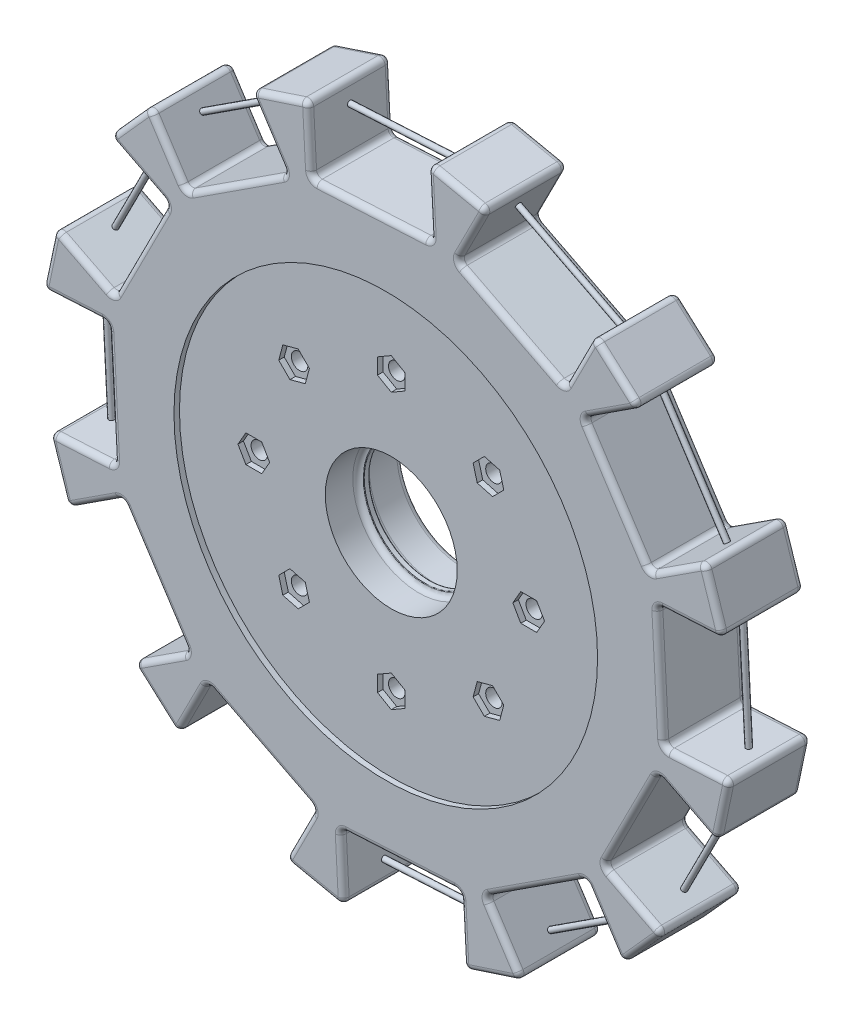
from build123d import *

# Parameters (mm, degrees)
BOSS_EXTRUDE1_DEPTH  = 15
SKETCH3_R            = 12
CUT_EXTRUDE1_DEPTH   = 7
CUT_EXTRUDE2_START   = -7
SKETCH4_R            = 12
CUT_EXTRUDE2_DEPTH   = 7
SKETCH5_R            = 11
CUT_EXTRUDE3_DEPTH   = 7
FILLET1_R            = 1
FILLET2_R            = 1
FILLET3_R            = 0.1
SKETCH6_R            = 1.5
CUT_EXTRUDE4_DEPTH   = 37
CUT_EXTRUDE5_DEPTH   = 2
CUT_EXTRUDE6_DEPTH   = 2
SKETCH9_R            = 0.5
BOSS_EXTRUDE2_DEPTH  = 23
SKETCH10_R           = 0.5
BOSS_EXTRUDE3_DEPTH  = 23
SKETCH11_R           = 0.5
BOSS_EXTRUDE4_DEPTH  = 23
SKETCH12_R           = 0.5
BOSS_EXTRUDE5_DEPTH  = 23
SKETCH13_R           = 0.5
BOSS_EXTRUDE6_DEPTH  = 23
SKETCH14_R           = 0.5
BOSS_EXTRUDE7_DEPTH  = 23
SKETCH15_R           = 0.5
BOSS_EXTRUDE8_DEPTH  = 23
SKETCH16_R           = 0.5
BOSS_EXTRUDE9_DEPTH  = 23
SKETCH17_R           = 0.5
BOSS_EXTRUDE10_DEPTH = 23
SKETCH18_R           = 0.5
BOSS_EXTRUDE11_DEPTH = 23
SKETCH19_R           = 0.5
BOSS_EXTRUDE12_DEPTH = 23
SKETCH20_R           = 0.5
BOSS_EXTRUDE13_DEPTH = 23
SKETCH23_R           = 38.523903913
CUT_EXTRUDE8_DEPTH   = 1
SKETCH24_R           = 1
BOSS_EXTRUDE14_DEPTH = 1
FILLET4_R            = 0.5
SKETCH25_R           = 1
CUT_EXTRUDE9_DEPTH   = 1
FILLET5_R            = 0.5


with BuildPart() as part:
    # Sketch1 → Boss-Extrude1 (new body)
    with BuildSketch(Plane.XY):
        with BuildLine():
            Line((-18.67460281, 48.693057371), (-23.963115728, 56.82298102))
            ThreePointArc((-23.963115728, 56.82298102), (-24.067993911, 57.700686954), (-23.435941035, 58.318648361))
            Line((-23.435941035, 58.318648361), (-15.41218335, 60.944964427))
            ThreePointArc((-15.41218335, 60.944964427), (-14.535909679, 60.819536384), (-14.102516823, 60.047682529))
            Line((-14.102516823, 60.047682529), (-13.586792283, 50.349545451))
            ThreePointArc((-13.586792283, 50.349545451), (-13.256763068, 49.658989765), (-12.535100564, 49.404059053))
            Line((-12.535100564, 49.404059053), (7.228361849, 50.455034357))
            ThreePointArc((7.228361849, 50.455034357), (7.918917534, 50.785063572), (8.173848247, 51.506726076))
            Line((8.173848247, 51.506726076), (7.658823536, 61.191702946))
            ThreePointArc((7.658823536, 61.191702946), (8.006849332, 62.004257673), (8.863203883, 62.223401512))
            Line((8.863203883, 62.223401512), (17.125139904, 60.485979101))
            ThreePointArc((17.125139904, 60.485979101), (17.821301143, 59.939218395), (17.810703439, 59.05407692))
            Line((17.810703439, 59.05407692), (13.408265453, 50.397381571))
            ThreePointArc((13.408265453, 50.397381571), (13.348801294, 49.634328197), (13.846313999, 49.052720472))
            Line((13.846313999, 49.052720472), (31.487462167, 40.081160577))
            ThreePointArc((31.487462167, 40.081160577), (32.250515541, 40.021696419), (32.832123266, 40.519209124))
            Line((32.832123266, 40.519209124), (37.228587219, 49.164157484))
            ThreePointArc((37.228587219, 49.164157484), (37.936263762, 49.693837622), (38.787460477, 49.455444478))
            Line((38.787460477, 49.455444478), (45.073795751, 43.819824522))
            ThreePointArc((45.073795751, 43.819824522), (45.403308716, 42.998235241), (44.951560097, 42.23697909))
            Line((44.951560097, 42.23697909), (36.810589288, 36.941279998))
            ThreePointArc((36.810589288, 36.941279998), (36.377565129, 36.310188471), (36.517619908, 35.557745054))
            Line((36.517619908, 35.557745054), (47.309522426, 18.967572189))
            ThreePointArc((47.309522426, 18.967572189), (47.940613953, 18.534548031), (48.693057371, 18.67460281))
            Line((48.693057371, 18.67460281), (56.82298102, 23.963115728))
            ThreePointArc((56.82298102, 23.963115728), (57.700686954, 24.067993911), (58.318648361, 23.435941035))
            Line((58.318648361, 23.435941035), (60.944964427, 15.41218335))
            ThreePointArc((60.944964427, 15.41218335), (60.819536384, 14.535909679), (60.047682529, 14.102516823))
            Line((60.047682529, 14.102516823), (50.349545451, 13.586792283))
            ThreePointArc((50.349545451, 13.586792283), (49.658989765, 13.256763068), (49.404059053, 12.535100564))
            Line((49.404059053, 12.535100564), (50.455034357, -7.228361849))
            ThreePointArc((50.455034357, -7.228361849), (50.785063572, -7.918917534), (51.506726076, -8.173848247))
            Line((51.506726076, -8.173848247), (61.191702946, -7.658823536))
            ThreePointArc((61.191702946, -7.658823536), (62.004257673, -8.006849332), (62.223401512, -8.863203883))
            Line((62.223401512, -8.863203883), (60.485979101, -17.125139904))
            ThreePointArc((60.485979101, -17.125139904), (59.939218395, -17.821301143), (59.05407692, -17.810703439))
            Line((59.05407692, -17.810703439), (50.397381571, -13.408265453))
            ThreePointArc((50.397381571, -13.408265453), (49.634328197, -13.348801294), (49.052720472, -13.846313999))
            Line((49.052720472, -13.846313999), (40.081160577, -31.487462167))
            ThreePointArc((40.081160577, -31.487462167), (40.021696419, -32.250515541), (40.519209124, -32.832123266))
            Line((40.519209124, -32.832123266), (49.164157484, -37.228587219))
            ThreePointArc((49.164157484, -37.228587219), (49.693837622, -37.936263762), (49.455444478, -38.787460477))
            Line((49.455444478, -38.787460477), (43.819824522, -45.073795751))
            ThreePointArc((43.819824522, -45.073795751), (42.998235241, -45.403308716), (42.23697909, -44.951560097))
            Line((42.23697909, -44.951560097), (36.941279998, -36.810589288))
            ThreePointArc((36.941279998, -36.810589288), (36.310188471, -36.377565129), (35.557745054, -36.517619908))
            Line((35.557745054, -36.517619908), (18.967572189, -47.309522426))
            ThreePointArc((18.967572189, -47.309522426), (18.534548031, -47.940613953), (18.67460281, -48.693057371))
            Line((18.67460281, -48.693057371), (23.963115728, -56.82298102))
            ThreePointArc((23.963115728, -56.82298102), (24.067993911, -57.700686954), (23.435941035, -58.318648361))
            Line((23.435941035, -58.318648361), (15.41218335, -60.944964427))
            ThreePointArc((15.41218335, -60.944964427), (14.535909679, -60.819536384), (14.102516823, -60.047682529))
            Line((14.102516823, -60.047682529), (13.586792283, -50.349545451))
            ThreePointArc((13.586792283, -50.349545451), (13.256763068, -49.658989765), (12.535100564, -49.404059053))
            Line((12.535100564, -49.404059053), (-7.228361849, -50.455034357))
            ThreePointArc((-7.228361849, -50.455034357), (-7.918917534, -50.785063572), (-8.173848247, -51.506726076))
            Line((-8.173848247, -51.506726076), (-7.658823536, -61.191702946))
            ThreePointArc((-7.658823536, -61.191702946), (-8.006849332, -62.004257673), (-8.863203883, -62.223401512))
            Line((-8.863203883, -62.223401512), (-17.125139904, -60.485979101))
            ThreePointArc((-17.125139904, -60.485979101), (-17.821301143, -59.939218395), (-17.810703439, -59.05407692))
            Line((-17.810703439, -59.05407692), (-13.408265453, -50.397381571))
            ThreePointArc((-13.408265453, -50.397381571), (-13.348801294, -49.634328197), (-13.846313999, -49.052720472))
            Line((-13.846313999, -49.052720472), (-31.487462167, -40.081160577))
            ThreePointArc((-31.487462167, -40.081160577), (-32.250515541, -40.021696419), (-32.832123266, -40.519209124))
            Line((-32.832123266, -40.519209124), (-37.228587219, -49.164157484))
            ThreePointArc((-37.228587219, -49.164157484), (-37.936263762, -49.693837622), (-38.787460477, -49.455444478))
            Line((-38.787460477, -49.455444478), (-45.073795751, -43.819824522))
            ThreePointArc((-45.073795751, -43.819824522), (-45.403308716, -42.998235241), (-44.951560097, -42.23697909))
            Line((-44.951560097, -42.23697909), (-36.810589288, -36.941279998))
            ThreePointArc((-36.810589288, -36.941279998), (-36.377565129, -36.310188471), (-36.517619908, -35.557745054))
            Line((-36.517619908, -35.557745054), (-47.309522426, -18.967572189))
            ThreePointArc((-47.309522426, -18.967572189), (-47.940613953, -18.534548031), (-48.693057371, -18.67460281))
            Line((-48.693057371, -18.67460281), (-56.82298102, -23.963115728))
            ThreePointArc((-56.82298102, -23.963115728), (-57.700686954, -24.067993911), (-58.318648361, -23.435941035))
            Line((-58.318648361, -23.435941035), (-60.944964427, -15.41218335))
            ThreePointArc((-60.944964427, -15.41218335), (-60.819536384, -14.535909679), (-60.047682529, -14.102516823))
            Line((-60.047682529, -14.102516823), (-50.349545451, -13.586792283))
            ThreePointArc((-50.349545451, -13.586792283), (-49.658989765, -13.256763068), (-49.404059053, -12.535100564))
            Line((-49.404059053, -12.535100564), (-50.455034357, 7.228361849))
            ThreePointArc((-50.455034357, 7.228361849), (-50.785063572, 7.918917534), (-51.506726076, 8.173848247))
            Line((-51.506726076, 8.173848247), (-61.191702946, 7.658823536))
            ThreePointArc((-61.191702946, 7.658823536), (-62.004257673, 8.006849332), (-62.223401512, 8.863203883))
            Line((-62.223401512, 8.863203883), (-60.485979101, 17.125139904))
            ThreePointArc((-60.485979101, 17.125139904), (-59.939218395, 17.821301143), (-59.05407692, 17.810703439))
            Line((-59.05407692, 17.810703439), (-50.397381571, 13.408265453))
            ThreePointArc((-50.397381571, 13.408265453), (-49.634328197, 13.348801294), (-49.052720472, 13.846313999))
            Line((-49.052720472, 13.846313999), (-40.081160577, 31.487462167))
            ThreePointArc((-40.081160577, 31.487462167), (-40.021696419, 32.250515541), (-40.519209124, 32.832123266))
            Line((-40.519209124, 32.832123266), (-49.164157484, 37.228587219))
            ThreePointArc((-49.164157484, 37.228587219), (-49.693837622, 37.936263762), (-49.455444478, 38.787460477))
            Line((-49.455444478, 38.787460477), (-43.819824522, 45.073795751))
            ThreePointArc((-43.819824522, 45.073795751), (-42.998235241, 45.403308716), (-42.23697909, 44.951560097))
            Line((-42.23697909, 44.951560097), (-36.941279998, 36.810589288))
            ThreePointArc((-36.941279998, 36.810589288), (-36.310188471, 36.377565129), (-35.557745054, 36.517619908))
            Line((-35.557745054, 36.517619908), (-18.967572189, 47.309522426))
            ThreePointArc((-18.967572189, 47.309522426), (-18.534548031, 47.940613953), (-18.67460281, 48.693057371))
        make_face()
    extrude(amount=BOSS_EXTRUDE1_DEPTH)

    # Sketch3 → Cut-Extrude1 (cut)
    with BuildSketch(Plane.XY.offset(15)):
        Circle(SKETCH3_R)
    extrude(amount=-CUT_EXTRUDE1_DEPTH, mode=Mode.SUBTRACT)

    # Sketch4 → Cut-Extrude2 (cut)
    with BuildSketch(Plane(origin=(0, 0, 0), x_dir=(-1, 0, 0), z_dir=(0, 0, -1)).offset(CUT_EXTRUDE2_START)):
        with Locations(Location((0, 0, 0), (0, 0, 180))):
            Circle(SKETCH4_R)
    extrude(amount=CUT_EXTRUDE2_DEPTH, mode=Mode.SUBTRACT)

    # Sketch5 → Cut-Extrude3 (cut)
    with BuildSketch(Plane(origin=(0, 0, 7), x_dir=(-1, 0, 0), z_dir=(0, 0, -1))):
        Circle(SKETCH5_R)
    extrude(amount=-CUT_EXTRUDE3_DEPTH, mode=Mode.SUBTRACT)

    # Fillet1
    fillet1_edges = [part.edges().sort_by_distance(p)[0] for p in [
        (49.658989765, 13.256763068, 0),
        (49.929546705, 2.653369357, 0),
        (-36.377565129, -36.310188471, 15),
        (50.785063572, -7.918917534, 0),
        (56.349214511, -7.916335891, 0),
        (62.004257673, -8.006849332, 0),
        (61.354690307, -12.994171894, 0),
        (59.939218395, -17.821301143, 0),
        (54.725729245, -15.609484446, 0),
        (49.634328197, -13.348801294, 0),
        (44.566940525, -22.666888083, 0),
        (40.021696419, -32.250515541, 0),
        (44.841683304, -35.030355242, 0),
        (-40.881074693, -39.589129544, 15),
        (49.693837622, -37.936263762, 0),
        (46.6376345, -41.930628114, 0),
        (42.998235241, -45.403308716, 0),
        (39.589129544, -40.881074693, 0),
        (36.310188471, -36.377565129, 0),
        (27.262658622, -41.913571167, 0),
        (18.534548031, -47.940613953, 0),
        (21.318859269, -52.758019195, 0),
        (24.067993911, -57.700686954, 0),
        (19.424062192, -59.631806394, 0),
        (-45.403308716, -42.998235241, 15),
        (14.535909679, -60.819536384, 0),
        (13.844654553, -55.19861399, 0),
        (13.256763068, -49.658989765, 0),
        (2.653369357, -49.929546705, 0),
        (-7.918917534, -50.785063572, 0),
        (-7.916335891, -56.349214511, 0),
        (-8.006849332, -62.004257673, 0),
        (-12.994171894, -61.354690307, 0),
        (-17.821301143, -59.939218395, 0),
        (-15.609484446, -54.725729245, 0),
        (-41.930628114, -46.6376345, 15),
        (-13.348801294, -49.634328197, 0),
        (-22.666888083, -44.566940525, 0),
        (-32.250515541, -40.021696419, 0),
        (-35.030355242, -44.841683304, 0),
        (-37.936263762, -49.693837622, 0),
        (-41.930628114, -46.6376345, 0),
        (-45.403308716, -42.998235241, 0),
        (-40.881074693, -39.589129544, 0),
        (-36.377565129, -36.310188471, 0),
        (-41.913571167, -27.262658622, 0),
        (-37.936263762, -49.693837622, 15),
        (-47.940613953, -18.534548031, 0),
        (-52.758019195, -21.318859269, 0),
        (-57.700686954, -24.067993911, 0),
        (-59.631806394, -19.424062192, 0),
        (-60.819536384, -14.535909679, 0),
        (-55.19861399, -13.844654553, 0),
        (-49.658989765, -13.256763068, 0),
        (-49.929546705, -2.653369357, 0),
        (-50.785063572, 7.918917534, 0),
        (-56.349214511, 7.916335891, 0),
        (-35.030355242, -44.841683304, 15),
        (-62.004257673, 8.006849332, 0),
        (-61.354690307, 12.994171894, 0),
        (-59.939218395, 17.821301143, 0),
        (-54.725729245, 15.609484446, 0),
        (-49.634328197, 13.348801294, 0),
        (-44.566940525, 22.666888083, 0),
        (-40.021696419, 32.250515541, 0),
        (-44.841683304, 35.030355242, 0),
        (-49.693837622, 37.936263762, 0),
        (-46.6376345, 41.930628114, 0),
        (-32.250515541, -40.021696419, 15),
        (-42.998235241, 45.403308716, 0),
        (-39.589129544, 40.881074693, 0),
        (-36.310188471, 36.377565129, 0),
        (-22.666888083, -44.566940525, 15),
        (-42.998235241, 45.403308716, 15),
        (-13.348801294, -49.634328197, 15),
        (-15.609484446, -54.725729245, 15),
        (-17.821301143, -59.939218395, 15),
        (-12.994171894, -61.354690307, 15),
        (-8.006849332, -62.004257673, 15),
        (-7.916335891, -56.349214511, 15),
        (-7.918917534, -50.785063572, 15),
        (2.653369357, -49.929546705, 15),
        (13.256763068, -49.658989765, 15),
        (13.844654553, -55.19861399, 15),
        (-46.6376345, 41.930628114, 15),
        (14.535909679, -60.819536384, 15),
        (19.424062192, -59.631806394, 15),
        (24.067993911, -57.700686954, 15),
        (21.318859269, -52.758019195, 15),
        (18.534548031, -47.940613953, 15),
        (27.262658622, -41.913571167, 15),
        (36.310188471, -36.377565129, 15),
        (39.589129544, -40.881074693, 15),
        (42.998235241, -45.403308716, 15),
        (46.6376345, -41.930628114, 15),
        (-49.693837622, 37.936263762, 15),
        (49.693837622, -37.936263762, 15),
        (44.841683304, -35.030355242, 15),
        (40.021696419, -32.250515541, 15),
        (44.566940525, -22.666888083, 15),
        (49.634328197, -13.348801294, 15),
        (54.725729245, -15.609484446, 15),
        (59.939218395, -17.821301143, 15),
        (61.354690307, -12.994171894, 15),
        (62.004257673, -8.006849332, 15),
        (56.349214511, -7.916335891, 15),
        (-44.841683304, 35.030355242, 15),
        (50.785063572, -7.918917534, 15),
        (-12, 0, 15),
        (49.929546705, 2.653369357, 15),
        (-12, 0, 0),
        (49.658989765, 13.256763068, 15),
        (55.19861399, 13.844654553, 15),
        (60.819536384, 14.535909679, 15),
        (59.631806394, 19.424062192, 15),
        (57.700686954, 24.067993911, 15),
        (52.758019195, 21.318859269, 15),
        (47.940613953, 18.534548031, 15),
        (41.913571167, 27.262658622, 15),
        (-40.021696419, 32.250515541, 15),
        (36.377565129, 36.310188471, 15),
        (40.881074693, 39.589129544, 15),
        (45.403308716, 42.998235241, 15),
        (41.930628114, 46.6376345, 15),
        (37.936263762, 49.693837622, 15),
        (35.030355242, 44.841683304, 15),
        (32.250515541, 40.021696419, 15),
        (22.666888083, 44.566940525, 15),
        (13.348801294, 49.634328197, 15),
        (15.609484446, 54.725729245, 15),
        (-44.566940525, 22.666888083, 15),
        (17.821301143, 59.939218395, 15),
        (12.994171894, 61.354690307, 15),
        (8.006849332, 62.004257673, 15),
        (7.916335891, 56.349214511, 15),
        (7.918917534, 50.785063572, 15),
        (-2.653369357, 49.929546705, 15),
        (-13.256763068, 49.658989765, 15),
        (-13.844654553, 55.19861399, 15),
        (-14.535909679, 60.819536384, 15),
        (-19.424062192, 59.631806394, 15),
        (-49.634328197, 13.348801294, 15),
        (-24.067993911, 57.700686954, 15),
        (-21.318859269, 52.758019195, 15),
        (-18.534548031, 47.940613953, 15),
        (-27.262658622, 41.913571167, 15),
        (-54.725729245, 15.609484446, 15),
        (-59.939218395, 17.821301143, 15),
        (-61.354690307, 12.994171894, 15),
        (-36.310188471, 36.377565129, 15),
        (-62.004257673, 8.006849332, 15),
        (-56.349214511, 7.916335891, 15),
        (-50.785063572, 7.918917534, 15),
        (-49.929546705, -2.653369357, 15),
        (-49.658989765, -13.256763068, 15),
        (-55.19861399, -13.844654553, 15),
        (-60.819536384, -14.535909679, 15),
        (-59.631806394, -19.424062192, 15),
        (-57.700686954, -24.067993911, 15),
        (-27.262658622, 41.913571167, 0),
        (-18.534548031, 47.940613953, 0),
        (-21.318859269, 52.758019195, 0),
        (-52.758019195, -21.318859269, 15),
        (-24.067993911, 57.700686954, 0),
        (-19.424062192, 59.631806394, 0),
        (-14.535909679, 60.819536384, 0),
        (-39.589129544, 40.881074693, 15),
        (-13.844654553, 55.19861399, 0),
        (-13.256763068, 49.658989765, 0),
        (-2.653369357, 49.929546705, 0),
        (7.918917534, 50.785063572, 0),
        (7.916335891, 56.349214511, 0),
        (8.006849332, 62.004257673, 0),
        (12.994171894, 61.354690307, 0),
        (-47.940613953, -18.534548031, 15),
        (17.821301143, 59.939218395, 0),
        (15.609484446, 54.725729245, 0),
        (13.348801294, 49.634328197, 0),
        (22.666888083, 44.566940525, 0),
        (32.250515541, 40.021696419, 0),
        (35.030355242, 44.841683304, 0),
        (37.936263762, 49.693837622, 0),
        (41.930628114, 46.6376345, 0),
        (45.403308716, 42.998235241, 0),
        (40.881074693, 39.589129544, 0),
        (-41.913571167, -27.262658622, 15),
        (36.377565129, 36.310188471, 0),
        (41.913571167, 27.262658622, 0),
        (47.940613953, 18.534548031, 0),
        (52.758019195, 21.318859269, 0),
        (57.700686954, 24.067993911, 0),
        (59.631806394, 19.424062192, 0),
        (60.819536384, 14.535909679, 0),
        (55.19861399, 13.844654553, 0),
    ]]
    fillet(fillet1_edges, radius=FILLET1_R)

    # Fillet2
    fillet2_edges = [part.edges().sort_by_distance(p)[0] for p in [
        (-12, 0, 8),
        (-12, 0, 7),
    ]]
    fillet(fillet2_edges, radius=FILLET2_R - 0.0001)  # a hair under: the kernel refuses the full size

    # Fillet3
    fillet3_edges = [part.edges().sort_by_distance(p)[0] for p in [
        (11, 0, 8),
        (11, 0, 7),
    ]]
    fillet(fillet3_edges, radius=FILLET3_R)

    # Sketch6 → Cut-Extrude4 (cut)
    with BuildSketch(Plane(origin=(0, 0, 0), x_dir=(-1, 0, 0), z_dir=(0, 0, -1))):
        with Locations((0, 25)):
            Circle(SKETCH6_R)
        with Locations((17.67766953, 17.67766953)):
            Circle(SKETCH6_R)
        with Locations((25, 0)):
            Circle(SKETCH6_R)
        with Locations((17.67766953, -17.67766953)):
            Circle(SKETCH6_R)
        with Locations((0, -25)):
            Circle(SKETCH6_R)
        with Locations((-17.67766953, -17.67766953)):
            Circle(SKETCH6_R)
        with Locations((-25, 0)):
            Circle(SKETCH6_R)
        with Locations((-17.67766953, 17.67766953)):
            Circle(SKETCH6_R)
    extrude(amount=-CUT_EXTRUDE4_DEPTH, mode=Mode.SUBTRACT)

    # Sketch7 → Cut-Extrude5 (cut)
    with BuildSketch(Plane(origin=(0, 0, 0), x_dir=(-1, 0, 0), z_dir=(0, 0, -1))):
        Polygon((15.636428077, 15.636428077), (18.424815756, 14.889281851), (20.466057209, 16.930523303), (19.718910982, 19.718910982), (16.930523303, 20.466057209), (14.889281851, 18.424815756), align=None)
        Polygon((0, 22.113248654), (2.5, 23.556624327), (2.5, 26.443375673), (0, 27.886751346), (-2.5, 26.443375673), (-2.5, 23.556624327), align=None)
        Polygon((22.113248654, 0), (23.556624327, -2.5), (26.443375673, -2.5), (27.886751346, 0), (26.443375673, 2.5), (23.556624327, 2.5), align=None)
        Polygon((15.636428077, -15.636428077), (14.889281851, -18.424815756), (16.930523303, -20.466057209), (19.718910982, -19.718910982), (20.466057209, -16.930523303), (18.424815756, -14.889281851), align=None)
        Polygon((0, -22.113248654), (-2.5, -23.556624327), (-2.5, -26.443375673), (0, -27.886751346), (2.5, -26.443375673), (2.5, -23.556624327), align=None)
        Polygon((-15.636428077, -15.636428077), (-18.424815756, -14.889281851), (-20.466057209, -16.930523303), (-19.718910982, -19.718910982), (-16.930523303, -20.466057209), (-14.889281851, -18.424815756), align=None)
        Polygon((-22.113248654, 0), (-23.556624327, 2.5), (-26.443375673, 2.5), (-27.886751346, 0), (-26.443375673, -2.5), (-23.556624327, -2.5), align=None)
        Polygon((-15.636428077, 15.636428077), (-14.889281851, 18.424815756), (-16.930523303, 20.466057209), (-19.718910982, 19.718910982), (-20.466057209, 16.930523303), (-18.424815756, 14.889281851), align=None)
    extrude(amount=-CUT_EXTRUDE5_DEPTH, mode=Mode.SUBTRACT)

    # Sketch8 → Cut-Extrude6 (cut)
    with BuildSketch(Plane.XY.offset(15)):
        Polygon((15.636428077, 15.636428077), (18.424815756, 14.889281851), (20.466057209, 16.930523303), (19.718910982, 19.718910982), (16.930523303, 20.466057209), (14.889281851, 18.424815756), align=None)
        Polygon((0, 22.113248654), (2.5, 23.556624327), (2.5, 26.443375673), (0, 27.886751346), (-2.5, 26.443375673), (-2.5, 23.556624327), align=None)
        Polygon((22.113248654, 0), (23.556624327, -2.5), (26.443375673, -2.5), (27.886751346, 0), (26.443375673, 2.5), (23.556624327, 2.5), align=None)
        Polygon((15.636428077, -15.636428077), (14.889281851, -18.424815756), (16.930523303, -20.466057209), (19.718910982, -19.718910982), (20.466057209, -16.930523303), (18.424815756, -14.889281851), align=None)
        Polygon((0, -22.113248654), (-2.5, -23.556624327), (-2.5, -26.443375673), (0, -27.886751346), (2.5, -26.443375673), (2.5, -23.556624327), align=None)
        Polygon((-15.636428077, -15.636428077), (-18.424815756, -14.889281851), (-20.466057209, -16.930523303), (-19.718910982, -19.718910982), (-16.930523303, -20.466057209), (-14.889281851, -18.424815756), align=None)
        Polygon((-22.113248654, 0), (-23.556624327, 2.5), (-26.443375673, 2.5), (-27.886751346, 0), (-26.443375673, -2.5), (-23.556624327, -2.5), align=None)
        Polygon((-15.636428077, 15.636428077), (-14.889281851, 18.424815756), (-16.930523303, 20.466057209), (-19.718910982, 19.718910982), (-20.466057209, 16.930523303), (-18.424815756, 14.889281851), align=None)
    extrude(amount=-CUT_EXTRUDE6_DEPTH, mode=Mode.SUBTRACT)

    # Sketch9 → Boss-Extrude2 (add)
    with BuildSketch(Plane(origin=(-5.94027098, 9.131858099, 0), x_dir=(0.8382521621149944, 0.5452827823336597, 0), z_dir=(0.5452827823336597, -0.8382521621149944, 0))):
        with Locations(Location((58.024959321, 7.5, 0), (0, 0, 180))):
            Circle(SKETCH9_R)
    extrude(amount=BOSS_EXTRUDE2_DEPTH)

    # Sketch10 → Boss-Extrude3 (add)
    with BuildSketch(Plane(origin=(-0.578496524, 10.878556588, 0), x_dir=(0.9985890583356466, 0.05310266068971212, 0), z_dir=(0.053102660689712124, -0.9985890583356467, 0))):
        with Locations(Location((58.024959321, 7.5, 0), (0, 0, 180))):
            Circle(SKETCH10_R)
    extrude(amount=BOSS_EXTRUDE3_DEPTH)

    # Sketch11 → Boss-Extrude4 (add)
    with BuildSketch(Plane(origin=(4.938285608, 9.710354623, 0), x_dir=(0.8913548228047069, -0.45330627600198686, 0), z_dir=(-0.45330627600198686, -0.8913548228047069, 0))):
        with Locations(Location((58.024959321, 7.5, 0), (0, 0, 180))):
            Circle(SKETCH11_R)
    extrude(amount=BOSS_EXTRUDE4_DEPTH)

    # Sketch12 → Boss-Extrude5 (add)
    with BuildSketch(Plane(origin=(9.131858099, 5.94027098, 0), x_dir=(0, 0, 1), z_dir=(-0.8382521621149936, -0.5452827823336607, 0))):
        with Locations(Location((7.5, -58.024959321, 0), (0, 0, 90))):
            Circle(SKETCH12_R)
    extrude(amount=BOSS_EXTRUDE5_DEPTH)

    # Sketch13 → Boss-Extrude6 (add)
    with BuildSketch(Plane(origin=(10.878556588, 0.578496524, 0), x_dir=(0, 0, 1), z_dir=(-0.9985890583356466, -0.053102660689712554, 0))):
        with Locations(Location((7.5, -58.024959321, 0), (0, 0, 90))):
            Circle(SKETCH13_R)
    extrude(amount=BOSS_EXTRUDE6_DEPTH)

    # Sketch14 → Boss-Extrude7 (add)
    with BuildSketch(Plane(origin=(9.710354623, -4.938285608, 0), x_dir=(0, 0, 1), z_dir=(-0.8913548228047072, 0.45330627600198636, 0))):
        with Locations(Location((7.5, -58.024959321, 0), (0, 0, 90))):
            Circle(SKETCH14_R)
    extrude(amount=BOSS_EXTRUDE7_DEPTH)

    # Sketch15 → Boss-Extrude8 (add)
    with BuildSketch(Plane(origin=(5.94027098, -9.131858099, 0), x_dir=(0.8382521621149944, 0.5452827823336596, 0), z_dir=(-0.5452827823336596, 0.8382521621149944, 0))):
        with Locations((-58.024959321, -7.5)):
            Circle(SKETCH15_R)
    extrude(amount=BOSS_EXTRUDE8_DEPTH)

    # Sketch16 → Boss-Extrude9 (add)
    with BuildSketch(Plane(origin=(0.578496524, -10.878556588, 0), x_dir=(0.9985890583356466, 0.053102660689712505, 0), z_dir=(-0.0531026606897125, 0.9985890583356465, 0))):
        with Locations((-58.024959321, -7.5)):
            Circle(SKETCH16_R)
    extrude(amount=BOSS_EXTRUDE9_DEPTH)

    # Sketch17 → Boss-Extrude10 (add)
    with BuildSketch(Plane(origin=(-4.938285608, -9.710354623, 0), x_dir=(0.8913548228047073, -0.45330627600198614, 0), z_dir=(0.4533062760019862, 0.8913548228047075, 0))):
        with Locations((-58.024959321, -7.5)):
            Circle(SKETCH17_R)
    extrude(amount=BOSS_EXTRUDE10_DEPTH)

    # Sketch18 → Boss-Extrude11 (add)
    with BuildSketch(Plane(origin=(-9.131858099, -5.94027098, 0), x_dir=(0, 0, -1), z_dir=(0.8382521621149949, 0.5452827823336589, 0))):
        with Locations(Location((-7.5, 58.024959321, 0), (0, 0, 270))):
            Circle(SKETCH18_R)
    extrude(amount=BOSS_EXTRUDE11_DEPTH)

    # Sketch19 → Boss-Extrude12 (add)
    with BuildSketch(Plane(origin=(-10.878556588, -0.578496524, 0), x_dir=(0, 0, -1), z_dir=(0.9985890583356465, 0.05310266068971475, 0))):
        with Locations(Location((-7.5, 58.024959321, 0), (0, 0, 270))):
            Circle(SKETCH19_R)
    extrude(amount=BOSS_EXTRUDE12_DEPTH)

    # Sketch20 → Boss-Extrude13 (add)
    with BuildSketch(Plane(origin=(-9.710354623, 4.938285608, 0), x_dir=(0, 0, -1), z_dir=(0.8913548228047082, -0.4533062760019845, 0))):
        with Locations(Location((-7.5, 58.024959321, 0), (0, 0, 270))):
            Circle(SKETCH20_R)
    extrude(amount=BOSS_EXTRUDE13_DEPTH)

    # Sketch23 → Cut-Extrude8 (cut)
    with BuildSketch(Plane.XY.offset(15)):
        Circle(SKETCH23_R)
    extrude(amount=-CUT_EXTRUDE8_DEPTH, mode=Mode.SUBTRACT)

    # Sketch24 → Boss-Extrude14 (add)
    with BuildSketch(Plane(origin=(0, 0, 0), x_dir=(-1, 0, 0), z_dir=(0, 0, -1))):
        with Locations((2.12266669, 39.943638869)):
            Circle(SKETCH24_R)
    extrude(amount=BOSS_EXTRUDE14_DEPTH)

    # Fillet4
    fillet4_edges = [part.edges().sort_by_distance(p)[0] for p in [
        (-1.12266669, 39.943638869, -1),
    ]]
    fillet(fillet4_edges, radius=FILLET4_R)

    # Sketch25 → Cut-Extrude9 (cut)
    with BuildSketch(Plane(origin=(0, 0, 0), x_dir=(-1, 0, 0), z_dir=(0, 0, -1))):
        with Locations((-8.288588506, 39.131819541)):
            Circle(SKETCH25_R)
    extrude(amount=-CUT_EXTRUDE9_DEPTH, mode=Mode.SUBTRACT)

    # Fillet5
    fillet5_edges = [part.edges().sort_by_distance(p)[0] for p in [
        (9.288588506, 39.131819541, 1),
    ]]
    fillet(fillet5_edges, radius=FILLET5_R)


solid = part.part
